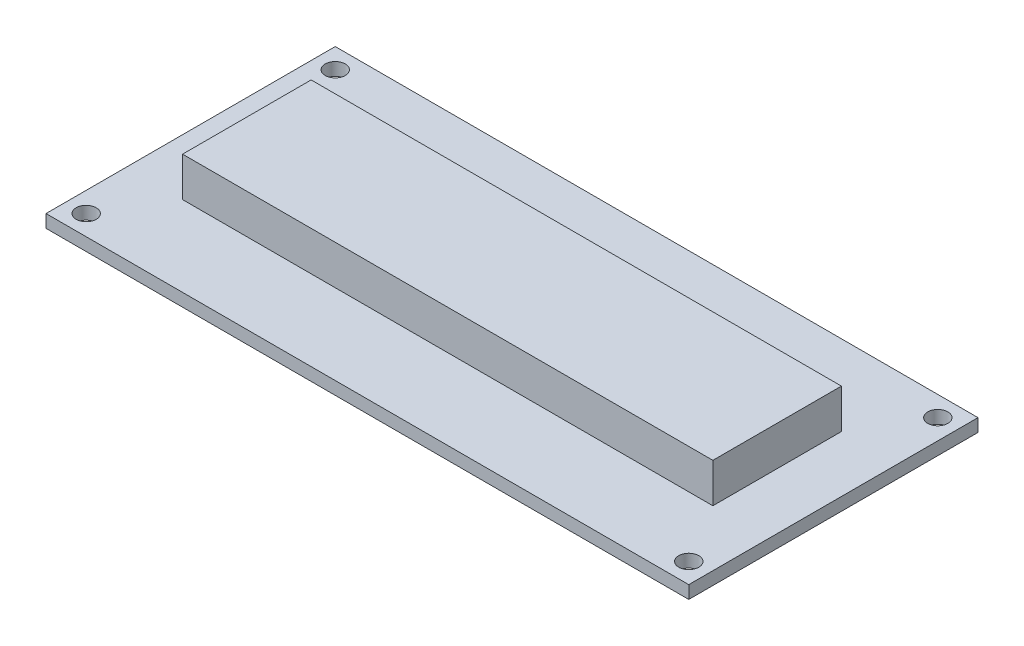
from build123d import *

# Parameters (mm, degrees)
SKETCH1_W               = 80
SKETCH1_H               = 36
BOSS_EXTRUDE1_DEPTH     = 1.6
SKETCH3_W               = 66
SKETCH3_H               = 16
BOSS_EXTRUDE2_DEPTH     = 4.9
SKETCH4_R               = 1.25
CUT_EXTRUDE1_DEPTH      = 4.9
MIRROR3_COPY_1_SKETCH_R = 1.25
MIRROR3_COPY_1_DEPTH    = 4.9


with BuildPart() as part:
    # Sketch1 → Boss-Extrude1 (new body)
    with BuildSketch(Plane(origin=(0, 0, 0), x_dir=(1, 0, 0), z_dir=(0, 1, 0))):
        Rectangle(SKETCH1_W, SKETCH1_H)
    extrude(amount=BOSS_EXTRUDE1_DEPTH)

    # Sketch3 → Boss-Extrude2 (add)
    with BuildSketch(Plane(origin=(0, 1.6, 0), x_dir=(1, 0, 0), z_dir=(0, 1, 0))):
        Rectangle(SKETCH3_W, SKETCH3_H)
    extrude(amount=BOSS_EXTRUDE2_DEPTH)

    # Sketch4 → Cut-Extrude1 (cut)
    with BuildSketch(Plane(origin=(0, 1.6, 0), x_dir=(1, 0, 0), z_dir=(0, 1, 0))):
        with Locations((-37.5, 15.5)):
            Circle(SKETCH4_R)
    cut_extrude1 = extrude(amount=-CUT_EXTRUDE1_DEPTH, mode=Mode.SUBTRACT)

    # Mirror2: Cut-Extrude1 across plane
    add(cut_extrude1.mirror(Plane.ZY), mode=Mode.SUBTRACT)

    # Mirror3: Cut-Extrude1 across plane
    add(cut_extrude1.mirror(Plane.XY), mode=Mode.SUBTRACT)

    # Mirror3 copy 1 sketch → Mirror3 copy 1 (cut)
    with BuildSketch(Plane(origin=(0, 1.6, 0), x_dir=(-1, 0, 0), z_dir=(0, 1, 0))):
        with Locations((-37.5, 15.5)):
            Circle(MIRROR3_COPY_1_SKETCH_R)
    extrude(amount=-MIRROR3_COPY_1_DEPTH, mode=Mode.SUBTRACT)


solid = part.part
